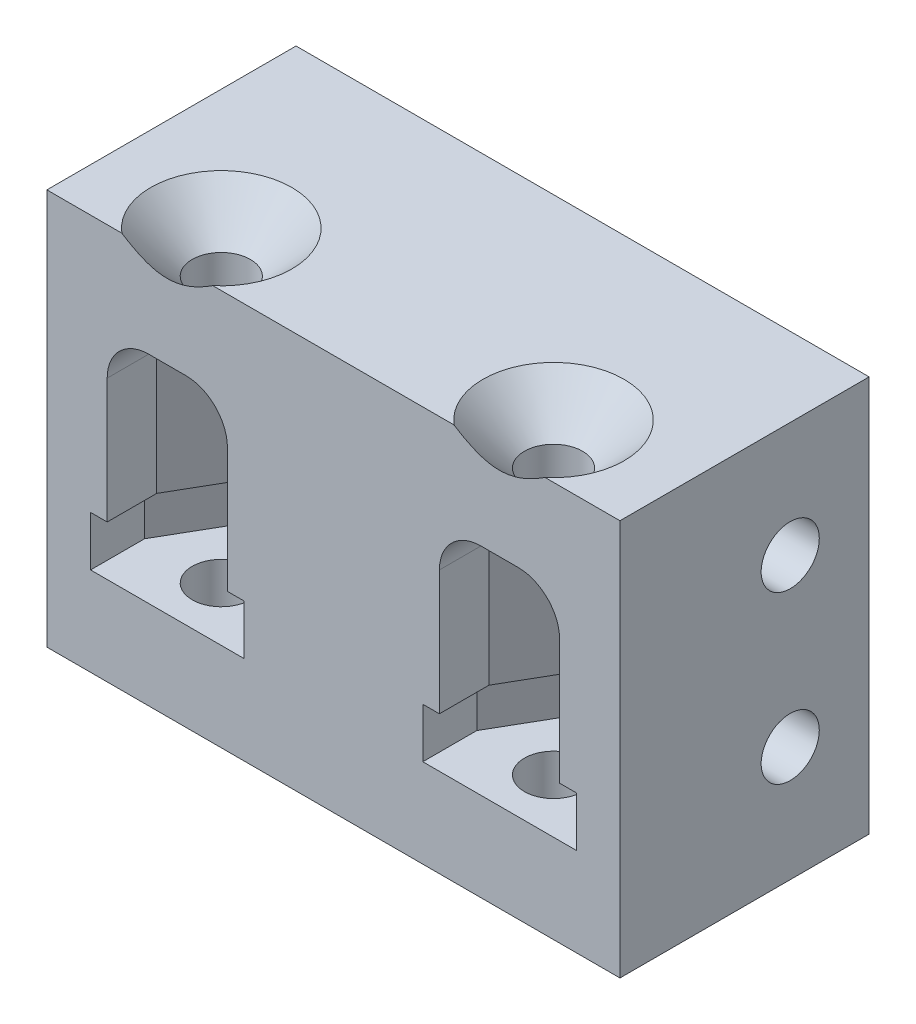
from build123d import *

# Parameters (mm, degrees)
SKETCH1_W           = 15
SKETCH1_H           = 23.84
SKETCH1_R           = 1.75
BOSS_EXTRUDE1_DEPTH = 17.25
SKETCH2_R           = 1.75
CUT_EXTRUDE1_DEPTH  = 31.367056163
CHAMFER1_SIZE       = 2.5
CUT_EXTRUDE2_DEPTH  = 1.5
CUT_EXTRUDE3_DEPTH  = 10
FILLET2_R           = 2.5


with BuildPart() as part:
    # Sketch1 → Boss-Extrude1 (new, symmetric)
    with BuildSketch(Plane(origin=(0, 0, 0), x_dir=(0, 0, -1), z_dir=(1, 0, 0))):
        Rectangle(SKETCH1_W, SKETCH1_H)
        with Locations((2.75, 5)):
            Circle(SKETCH1_R, mode=Mode.SUBTRACT)
        with Locations((2.75, -5)):
            Circle(SKETCH1_R, mode=Mode.SUBTRACT)
    extrude(amount=BOSS_EXTRUDE1_DEPTH, both=True)

    # Sketch2 → Cut-Extrude1 (cut, through all)
    with BuildSketch(Plane(origin=(0, 11.92, 0), x_dir=(1, 0, 0), z_dir=(0, 1, 0))):
        with Locations(Location((-10, -4.25, 0), (0, 0, 270))):
            Circle(SKETCH2_R)
        with Locations(Location((10, -4.25, 0), (0, 0, 270))):
            Circle(SKETCH2_R)
    extrude(amount=-CUT_EXTRUDE1_DEPTH, mode=Mode.SUBTRACT)

    # Chamfer1
    # the kernel refuses this chamfer: 2.5 mm, written as the material it takes off along each edge
    with BuildSketch(Plane(origin=(-10, 11.92, 4.25), x_dir=(0, 0, 1), z_dir=(-1, 0, 0))) as chamfer1_piece_1:
        Polygon((1.75, -CHAMFER1_SIZE), (1.75 + CHAMFER1_SIZE, 0), (1.75, 0), align=None)
    revolve(axis=Axis((-10, 11.92, 4.25), (0, 1, 0)), mode=Mode.SUBTRACT)
    with BuildSketch(Plane(origin=(10, 11.92, 4.25), x_dir=(0, 0, 1), z_dir=(-1, 0, 0))) as chamfer1_piece_2:
        Polygon((1.75, -CHAMFER1_SIZE), (1.75 + CHAMFER1_SIZE, 0), (1.75, 0), align=None)
    revolve(axis=Axis((10, 11.92, 4.25), (0, 1, 0)), mode=Mode.SUBTRACT)

    # Sketch3 → Cut-Extrude2 (cut, symmetric)
    with BuildSketch(Plane(origin=(0, -5.08, 0), x_dir=(1, 0, 0), z_dir=(0, 1, 0))):
        Polygon((-14.618802154, -4.25), (-14.618802154, -7.5), (-5.381197846, -7.5), (-5.381197846, -4.25), (-7.690598923, -0.25), (-12.309401077, -0.25), align=None)
        Polygon((14.618802154, -4.25), (12.309401077, -0.25), (7.690598923, -0.25), (5.381197846, -4.25), (5.381197846, -7.5), (14.618802154, -7.5), align=None)
    extrude(amount=CUT_EXTRUDE2_DEPTH, both=True, mode=Mode.SUBTRACT)

    # Sketch4 → Cut-Extrude3 (cut)
    with BuildSketch(Plane.XZ.offset(3.58)):
        Polygon((-13.618802154, 6.5), (-13.618802154, 7.5), (-6.381197846, 7.5), (-6.381197846, 6.5), (-6.381197846, 4.517949192), (-8.267949192, 1.25), (-11.732050808, 1.25), (-13.618802154, 4.517949192), align=None)
        Polygon((6.381197846, 6.5), (6.381197846, 7.5), (13.618802154, 7.5), (13.618802154, 6.5), (13.618802154, 4.517949192), (11.732050808, 1.25), (8.267949192, 1.25), (6.381197846, 4.517949192), align=None)
    extrude(amount=-CUT_EXTRUDE3_DEPTH, mode=Mode.SUBTRACT)

    # Fillet2
    # the kernel refuses this fillet: 2.5 mm, written as the material it adds along each edge
    with BuildSketch(Plane(origin=(-6.381197846, 6.42, -1.732050808), x_dir=(0, -1, 0), z_dir=(0, 0, 1))) as fillet2_piece_1_section:
        with BuildLine():
            CenterArc((FILLET2_R, -FILLET2_R), FILLET2_R, 90, 90)
            Line((0, -FILLET2_R), (0, 0))
            Line((0, 0), (FILLET2_R, 0))
        make_face()
    fillet2_piece_1 = extrude(amount=9.232050808, mode=Mode.PRIVATE)
    fillet2_piece_1 = fillet2_piece_1 - Plane(origin=(-10, 5.915860335, 4.25), x_dir=(0, 0, 1), z_dir=(0, 1, 0)) * Cylinder(1.75, 29, mode=Mode.PRIVATE)
    fillet2_piece_1 = split(fillet2_piece_1, bisect_by=Plane(origin=(-7.028837061, 5.915860335, 1.25), z_dir=(0, 0, 1)), keep=Keep.TOP, mode=Mode.PRIVATE)
    add(fillet2_piece_1)
    with BuildSketch(Plane(origin=(-3.256197846, 6.42, 9.930607966), x_dir=(-0.8660254037844386, 0, 0.5000000000000002), z_dir=(-0.5000000000000002, 0, -0.8660254037844386))) as fillet2_piece_2_section:
        with BuildLine():
            CenterArc((FILLET2_R, -FILLET2_R), FILLET2_R, 90, 90)
            Line((0, -FILLET2_R), (0, 0))
            Line((0, 0), (FILLET2_R, 0))
        make_face()
    fillet2_piece_2 = extrude(amount=16.273502692, mode=Mode.PRIVATE)
    fillet2_piece_2 = split(fillet2_piece_2, bisect_by=Plane(origin=(-7.669827192, 5.902188102, 7.5), z_dir=(0, 0, -1)), keep=Keep.TOP, mode=Mode.PRIVATE)
    fillet2_piece_2 = fillet2_piece_2 - Plane(origin=(-10, 5.902188102, 4.25), x_dir=(0, 0, 1), z_dir=(0, 1, 0)) * Cylinder(1.75, 43, mode=Mode.PRIVATE)
    fillet2_piece_2 = split(fillet2_piece_2, bisect_by=Plane(origin=(-7.669827192, 5.902188102, 1.25), z_dir=(0, 0, 1)), keep=Keep.TOP, mode=Mode.PRIVATE)
    add(fillet2_piece_2)
    with BuildSketch(Plane(origin=(-2.017949192, 6.42, 1.25), x_dir=(0, 0, 1), z_dir=(-1, 0, 0))) as fillet2_piece_3_section:
        with BuildLine():
            CenterArc((FILLET2_R, -FILLET2_R), FILLET2_R, 90, 90)
            Line((0, -FILLET2_R), (0, 0))
            Line((0, 0), (FILLET2_R, 0))
        make_face()
    fillet2_piece_3 = extrude(amount=15.964101615, mode=Mode.PRIVATE)
    fillet2_piece_3 = fillet2_piece_3 - Plane(origin=(-10, 5.877722241, 4.25), x_dir=(0, 0, 1), z_dir=(0, 1, 0)) * Cylinder(1.75, 42, mode=Mode.PRIVATE)
    fillet2_piece_3 = split(fillet2_piece_3, bisect_by=Plane(origin=(-11.54711457, 5.877722241, 0.92968104), z_dir=(0.8660254037844384, 0, 0.5000000000000006)), keep=Keep.TOP, mode=Mode.PRIVATE)
    add(fillet2_piece_3)
    with BuildSketch(Plane(origin=(-8.607050808, 6.42, -4.162658774), x_dir=(0.8660254037844384, 0, 0.5000000000000004), z_dir=(-0.5000000000000006, 0, 0.8660254037844384))) as fillet2_piece_4_section:
        with BuildLine():
            CenterArc((FILLET2_R, -FILLET2_R), FILLET2_R, 90, 90)
            Line((0, -FILLET2_R), (0, 0))
            Line((0, 0), (FILLET2_R, 0))
        make_face()
    fillet2_piece_4 = extrude(amount=16.273502692, mode=Mode.PRIVATE)
    fillet2_piece_4 = split(fillet2_piece_4, bisect_by=Plane(origin=(-12.330172795, 5.902188104, 7.5), z_dir=(0, 0, -1)), keep=Keep.TOP, mode=Mode.PRIVATE)
    fillet2_piece_4 = fillet2_piece_4 - Plane(origin=(-10, 5.902188104, 4.25), x_dir=(0, 0, 1), z_dir=(0, 1, 0)) * Cylinder(1.75, 43, mode=Mode.PRIVATE)
    fillet2_piece_4 = split(fillet2_piece_4, bisect_by=Plane(origin=(-12.330172795, 5.902188104, 1.25), z_dir=(0, 0, 1)), keep=Keep.TOP, mode=Mode.PRIVATE)
    add(fillet2_piece_4)
    with BuildSketch(Plane(origin=(-13.618802154, 6.42, 7.5), x_dir=(1, 0, 0), z_dir=(0, 0, -1))) as fillet2_piece_5_section:
        with BuildLine():
            CenterArc((FILLET2_R, FILLET2_R), FILLET2_R, 180, 90)
            Line((0, FILLET2_R), (0, 0))
            Line((0, 0), (FILLET2_R, 0))
        make_face()
    fillet2_piece_5 = extrude(amount=9.232050808, mode=Mode.PRIVATE)
    fillet2_piece_5 = fillet2_piece_5 - Plane(origin=(-10, 5.915860467, 4.25), x_dir=(0, 0, 1), z_dir=(0, 1, 0)) * Cylinder(1.75, 29, mode=Mode.PRIVATE)
    fillet2_piece_5 = split(fillet2_piece_5, bisect_by=Plane(origin=(-13.860643718, 5.915860467, 4.936831069), z_dir=(0.8660254037844384, 0, 0.5000000000000006)), keep=Keep.TOP, mode=Mode.PRIVATE)
    add(fillet2_piece_5)
    with BuildSketch(Plane(origin=(13.618802154, 6.42, -1.732050808), x_dir=(0, -1, 0), z_dir=(0, 0, 1))) as fillet2_piece_6_section:
        with BuildLine():
            CenterArc((FILLET2_R, -FILLET2_R), FILLET2_R, 90, 90)
            Line((0, -FILLET2_R), (0, 0))
            Line((0, 0), (FILLET2_R, 0))
        make_face()
    fillet2_piece_6 = extrude(amount=9.232050808, mode=Mode.PRIVATE)
    fillet2_piece_6 = fillet2_piece_6 - Plane(origin=(10, 5.915860335, 4.25), x_dir=(0, 0, 1), z_dir=(0, 1, 0)) * Cylinder(1.75, 29, mode=Mode.PRIVATE)
    fillet2_piece_6 = split(fillet2_piece_6, bisect_by=Plane(origin=(12.971162939, 5.915860335, 1.25), z_dir=(0, 0, 1)), keep=Keep.TOP, mode=Mode.PRIVATE)
    add(fillet2_piece_6)
    with BuildSketch(Plane(origin=(16.743802154, 6.42, 9.930607966), x_dir=(-0.8660254037844389, 0, 0.49999999999999956), z_dir=(-0.4999999999999996, 0, -0.8660254037844389))) as fillet2_piece_7_section:
        with BuildLine():
            CenterArc((FILLET2_R, -FILLET2_R), FILLET2_R, 90, 90)
            Line((0, -FILLET2_R), (0, 0))
            Line((0, 0), (FILLET2_R, 0))
        make_face()
    fillet2_piece_7 = extrude(amount=16.273502692, mode=Mode.PRIVATE)
    fillet2_piece_7 = split(fillet2_piece_7, bisect_by=Plane(origin=(12.330172808, 5.902188102, 7.5), z_dir=(0, 0, -1)), keep=Keep.TOP, mode=Mode.PRIVATE)
    fillet2_piece_7 = fillet2_piece_7 - Plane(origin=(10, 5.902188102, 4.25), x_dir=(0, 0, 1), z_dir=(0, 1, 0)) * Cylinder(1.75, 43, mode=Mode.PRIVATE)
    fillet2_piece_7 = split(fillet2_piece_7, bisect_by=Plane(origin=(12.330172808, 5.902188102, 1.25), z_dir=(0, 0, 1)), keep=Keep.TOP, mode=Mode.PRIVATE)
    add(fillet2_piece_7)
    with BuildSketch(Plane(origin=(17.982050808, 6.42, 1.25), x_dir=(0, 0, 1), z_dir=(-1, 0, 0))) as fillet2_piece_8_section:
        with BuildLine():
            CenterArc((FILLET2_R, -FILLET2_R), FILLET2_R, 90, 90)
            Line((0, -FILLET2_R), (0, 0))
            Line((0, 0), (FILLET2_R, 0))
        make_face()
    fillet2_piece_8 = extrude(amount=15.964101615, mode=Mode.PRIVATE)
    fillet2_piece_8 = fillet2_piece_8 - Plane(origin=(10, 5.877722241, 4.25), x_dir=(0, 0, 1), z_dir=(0, 1, 0)) * Cylinder(1.75, 42, mode=Mode.PRIVATE)
    fillet2_piece_8 = split(fillet2_piece_8, bisect_by=Plane(origin=(11.547114576, 5.877722241, 0.92968105), z_dir=(-0.8660254037844389, 0, 0.4999999999999996)), keep=Keep.TOP, mode=Mode.PRIVATE)
    add(fillet2_piece_8)
    with BuildSketch(Plane(origin=(11.392949192, 6.42, -4.162658774), x_dir=(0.8660254037844389, 0, 0.49999999999999956), z_dir=(-0.4999999999999996, 0, 0.8660254037844389))) as fillet2_piece_9_section:
        with BuildLine():
            CenterArc((FILLET2_R, -FILLET2_R), FILLET2_R, 90, 90)
            Line((0, -FILLET2_R), (0, 0))
            Line((0, 0), (FILLET2_R, 0))
        make_face()
    fillet2_piece_9 = extrude(amount=16.273502692, mode=Mode.PRIVATE)
    fillet2_piece_9 = split(fillet2_piece_9, bisect_by=Plane(origin=(7.669827205, 5.902188104, 7.5), z_dir=(0, 0, -1)), keep=Keep.TOP, mode=Mode.PRIVATE)
    fillet2_piece_9 = fillet2_piece_9 - Plane(origin=(10, 5.902188104, 4.25), x_dir=(0, 0, 1), z_dir=(0, 1, 0)) * Cylinder(1.75, 43, mode=Mode.PRIVATE)
    fillet2_piece_9 = split(fillet2_piece_9, bisect_by=Plane(origin=(7.669827205, 5.902188104, 1.25), z_dir=(0, 0, 1)), keep=Keep.TOP, mode=Mode.PRIVATE)
    add(fillet2_piece_9)
    with BuildSketch(Plane(origin=(6.381197846, 6.42, 7.5), x_dir=(1, 0, 0), z_dir=(0, 0, -1))) as fillet2_piece_10_section:
        with BuildLine():
            CenterArc((FILLET2_R, FILLET2_R), FILLET2_R, 180, 90)
            Line((0, FILLET2_R), (0, 0))
            Line((0, 0), (FILLET2_R, 0))
        make_face()
    fillet2_piece_10 = extrude(amount=9.232050808, mode=Mode.PRIVATE)
    fillet2_piece_10 = fillet2_piece_10 - Plane(origin=(10, 5.915860467, 4.25), x_dir=(0, 0, 1), z_dir=(0, 1, 0)) * Cylinder(1.75, 29, mode=Mode.PRIVATE)
    fillet2_piece_10 = split(fillet2_piece_10, bisect_by=Plane(origin=(6.139356282, 5.915860467, 4.936831069), z_dir=(0.8660254037844389, 0, 0.4999999999999996)), keep=Keep.TOP, mode=Mode.PRIVATE)
    add(fillet2_piece_10)


solid = part.part
